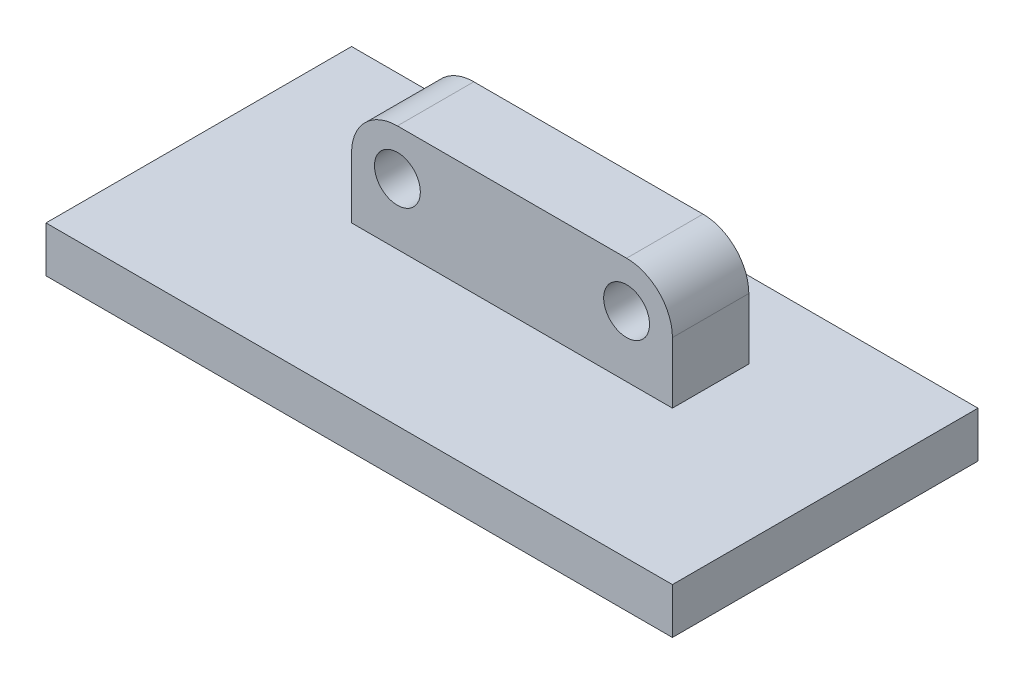
from build123d import *

# Parameters (mm, degrees)
SKETCH_1_R      = 1.5
EXTRUDE_1_DEPTH = 5
SKETCH_2_W      = 41
SKETCH_2_H      = 20
EXTRUDE_2_DEPTH = 3


with BuildPart() as part:
    # ｽｹｯﾁ1 → ﾎﾞｽ - 押し出し1 (new body)
    with BuildSketch(Plane.XY):
        with BuildLine():
            Line((-3, -4), (18, -4))
            Line((18, -4), (18, 0))
            ThreePointArc((18, 0), (17.121320344, 2.121320344), (15, 3))
            Line((15, 3), (0, 3))
            ThreePointArc((0, 3), (-2.121320344, 2.121320344), (-3, 0))
            Line((-3, 0), (-3, -4))
        make_face()
        Circle(SKETCH_1_R, mode=Mode.SUBTRACT)
        with Locations((15, 0)):
            Circle(SKETCH_1_R, mode=Mode.SUBTRACT)
    extrude(amount=EXTRUDE_1_DEPTH)

    # ｽｹｯﾁ2 → ﾎﾞｽ - 押し出し2 (add)
    with BuildSketch(Plane.XZ.offset(4)):
        with Locations((7.5, 5)):
            Rectangle(SKETCH_2_W, SKETCH_2_H)
    extrude(amount=EXTRUDE_2_DEPTH)


solid = part.part
